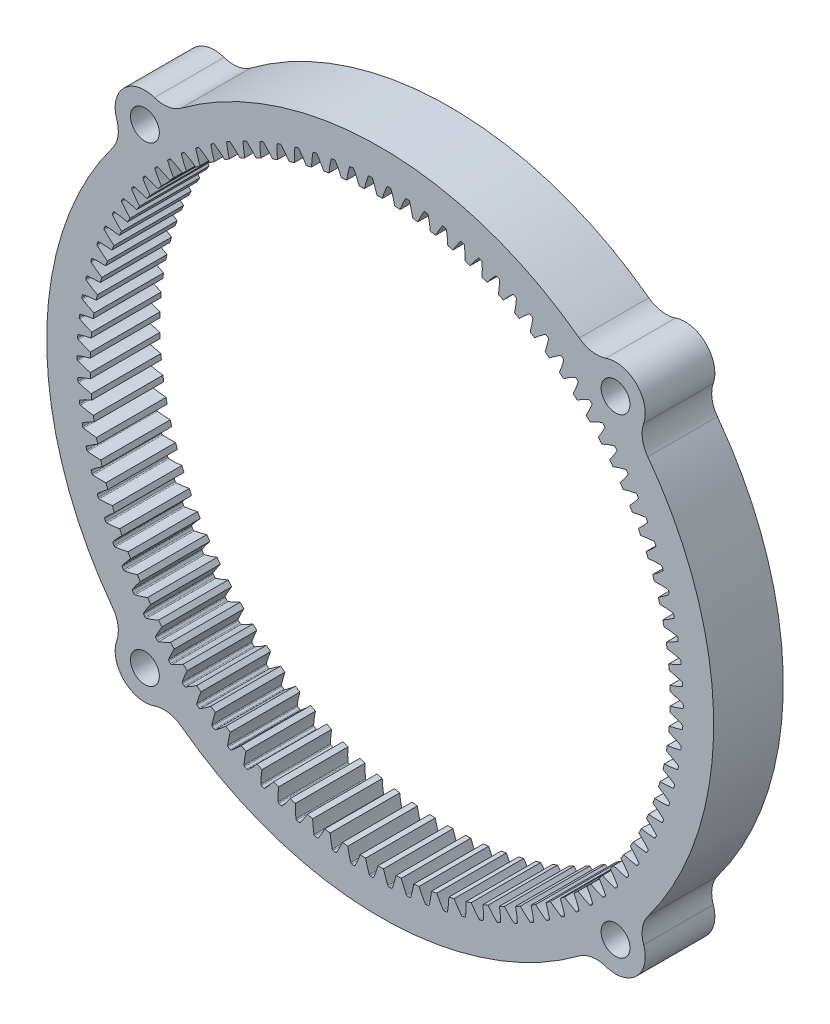
from build123d import *

# Parameters (mm, degrees)
SKETCH2_R           = 62.5
SKETCH2_R_2         = 50
BOSS_EXTRUDE1_DEPTH = 6
CUT_EXTRUDE2_START  = -7
CUT_EXTRUDE2_DEPTH  = 14
CIRPATTERN1_COUNT   = 102
FILLET1_R           = 0.2
SKETCH4_R           = 2.4892
CUT_EXTRUDE3_DEPTH  = 90.199215397
SKETCH5_OUTSIDE_W   = 162.436
SKETCH5_OUTSIDE_H   = 162.436
CUT_EXTRUDE5_DEPTH  = 90.199215397


with BuildPart() as part:
    # Sketch2 → Boss-Extrude1 (new, symmetric)
    with BuildSketch(Plane.XY):
        Circle(SKETCH2_R)
        Circle(SKETCH2_R_2, mode=Mode.SUBTRACT)
    extrude(amount=BOSS_EXTRUDE1_DEPTH, both=True)

    # Cut-Extrude2: read off the stored shape, not the designer's step
    # Cut-Extrude2 outline → Cut-Extrude2 (cut)
    with BuildSketch(Plane.XY.offset(CUT_EXTRUDE2_START)):
        with BuildLine():
            add(Edge.make_bspline(
                [(0.36845382, 49.998642399), (0.405796112, 50.131110984), (0.500958985, 50.452742938), (0.667166086, 50.959461897), (0.876071493, 51.517271253), (1.050120824, 51.940766609), (1.1530414, 52.179599707), (1.17792833, 52.236720656)],
                knots=[0.073064871, 0.073064871, 0.073064871, 0.073064871, 0.073064871, 0.092110525, 0.119476175, 0.146842495, 0.155464778, 0.155464778, 0.155464778, 0.155464778, 0.155464778], degree=4))
            ThreePointArc((0.36845382, 49.998642399), (1.442900025, 49.979176059), (2.516679717, 49.936623066))
            add(Edge.make_bspline(
                [(2.516679717, 49.936623066), (2.487041957, 50.071025326), (2.410593066, 50.397611659), (2.273896251, 50.913075385), (2.097519701, 51.482007868), (1.94819236, 51.914839178), (1.859221832, 52.15921226), (1.837671711, 52.217673954)],
                knots=[0.073064876, 0.073064876, 0.073064876, 0.073064876, 0.073064876, 0.092110525, 0.119476175, 0.146842495, 0.155464795, 0.155464795, 0.155464795, 0.155464795, 0.155464795], degree=4))
            ThreePointArc((1.837671711, 52.217673954), (1.507829971, 52.228238997), (1.17792833, 52.236720656))
        make_face()
    cut_extrude2 = extrude(amount=CUT_EXTRUDE2_DEPTH, mode=Mode.SUBTRACT)

    # CirPattern1: Cut-Extrude2 ×102 about axis
    cirpattern1_axis = Axis((0, 0, 6), (0, 0, -1))
    for i in range(1, CIRPATTERN1_COUNT):
        add(cut_extrude2.rotate(cirpattern1_axis, i * 360 / CIRPATTERN1_COUNT), mode=Mode.SUBTRACT)

    # Fillet1
    fillet1_edges = [part.edges().sort_by_distance(p)[0] for p in [
        (52.175671437, -2.786002533, 0),
        (52.136316933, -3.444846467, 0),
        (52.248220181, 0.43126321, 0),
        (52.249499349, -0.228753812, 0),
        (52.122573529, 3.646893023, 0),
        (52.164481517, 2.988206583, 0),
        (51.799208103, 6.848688923, 0),
        (51.881585939, 6.193831688, 0),
        (51.279350538, 10.024505399, 0),
        (51.401885734, 9.375961467, 0),
        (50.564972831, 13.162295493, 0),
        (50.727200571, 12.522525013, 0),
        (16.958198933, 49.421472955, 0),
        (17.581122052, 49.203319582, 0),
        (19.968465462, 48.283774574, 0),
        (20.576777381, 48.027687255, 0),
        (22.902984762, 46.962919299, 0),
        (23.494377945, 46.66986946, 0),
        (25.750625195, 45.463917584, 0),
        (26.322856287, 45.135016865, 0),
        (33.666144801, 39.958143028, 0),
        (34.168197223, 39.529695281, 0),
        (36.062150684, 37.809837187, 0),
        (36.536875246, 37.351295262, 0),
        (31.1424317, 41.954873947, 0),
        (31.669907524, 41.558145626, 0),
        (28.500584687, 43.792455658, 0),
        (29.051483019, 43.42895169, 0),
        (40.435204224, 33.091641836, 0),
        (40.849981182, 32.578237336, 0),
        (38.321360477, 35.518105682, 0),
        (38.766956386, 35.031208987, 0),
        (42.395663391, 30.539650058, 0),
        (42.778048007, 30.001685272, 0),
        (44.195301285, 27.871810927, 0),
        (44.543843044, 27.31132654, 0),
        (45.827291263, 25.09824447, 0),
        (46.140668026, 24.517366591, 0),
        (47.285442629, 22.229471776, 0),
        (47.56246565, 21.630403873, 0),
        (48.564224114, 19.27637508, 0),
        (48.803842551, 18.661389625, 0),
        (49.658784863, 16.250156491, 0),
        (49.860089761, 15.621586333, 0),
        (13.883604147, 50.37169876, 0),
        (14.518775504, 50.192306864, 0),
        (10.756344095, 51.130847458, 0),
        (11.401354269, 50.990897534, 0),
        (7.588281545, 51.696039338, 0),
        (8.240683791, 51.596062264, 0),
        (4.391434044, 52.065130434, 0),
        (5.048753577, 52.005505457, 0),
        (-2.04004567, 52.210159104, 0),
        (-1.380381073, 52.231762928, 0),
        (1.17792833, 52.236720656, 0),
        (1.837671711, 52.217673954, 0),
        (-5.250281078, 51.985546536, 0),
        (-4.593197599, 52.047718935, 0),
        (-8.440600371, 51.563734983, 0),
        (-7.788590553, 51.666240116, 0),
        (-11.598901576, 50.946324522, 0),
        (-10.954438715, 51.088773551, 0),
        (-14.713204175, 50.135657201, 0),
        (-14.078732939, 50.317509769, 0),
        (-17.77169455, 49.134808159, 0),
        (-17.149621706, 49.355374437, 0),
        (-20.762770801, 47.947573961, 0),
        (-20.155456085, 48.206017265, 0),
        (-23.67508675, 46.578458191, 0),
        (-23.084833914, 46.873798157, 0),
        (-26.497594986, 45.032654375, 0),
        (-25.926643061, 45.363770677, 0),
        (-44.649362933, 27.138476186, 0),
        (-44.302996315, 27.700307363, 0),
        (-42.894008585, 29.835658658, 0),
        (-42.513712074, 30.375101583, 0),
        (-38.902440768, 34.880690967, 0),
        (-38.458735492, 35.369311201, 0),
        (-40.975942569, 32.419664258, 0),
        (-40.56315876, 32.934672639, 0),
        (-29.219588768, 43.316026275, 0),
        (-28.670103571, 43.681662877, 0),
        (-31.830742641, 41.435085652, 0),
        (-31.304808558, 41.833855568, 0),
        (-36.681368684, 37.209403267, 0),
        (-36.208425067, 37.669781851, 0),
        (-34.321151605, 39.396967556, 0),
        (-33.820763683, 39.827358115, 0),
        (-46.235346955, 24.338348177, 0),
        (-45.924224117, 24.920436388, 0),
        (-47.645944469, 21.445896478, 0),
        (-47.371245606, 22.046033662, 0),
        (-48.875804595, 18.472093147, 0),
        (-48.638571734, 19.08800278, 0),
        (-49.920262053, 15.42821884, 0),
        (-49.721395101, 16.057564564, 0),
        (-50.775354859, 12.325820014, 0),
        (-50.615608184, 12.966214506, 0),
        (-51.437839351, 9.176665131, 0),
        (-51.317818929, 9.825679156, 0),
        (-51.9052025, 5.992700014, 0),
        (-51.825363609, 6.647871638, 0),
        (-52.175671437, 2.786002533, 0),
        (-52.136316933, 3.444846467, 0),
        (-52.248220181, -0.43126321, 0),
        (-52.249499349, 0.228753812, 0),
        (-52.122573529, -3.646893023, 0),
        (-52.164481517, -2.988206583, 0),
        (-51.799208103, -6.848688923, 0),
        (-51.881585939, -6.193831688, 0),
        (-51.279350538, -10.024505399, 0),
        (-51.401885734, -9.375961467, 0),
        (-50.564972831, -13.162295493, 0),
        (-50.727200571, -12.522525013, 0),
        (-49.658784863, -16.250156491, 0),
        (-49.860089761, -15.621586333, 0),
        (-48.564224114, -19.27637508, 0),
        (-48.803842551, -18.661389625, 0),
        (-47.285442629, -22.229471776, 0),
        (-47.56246565, -21.630403873, 0),
        (-36.062150684, -37.809837187, 0),
        (-36.536875246, -37.351295262, 0),
        (-38.321360477, -35.518105682, 0),
        (-38.766956386, -35.031208987, 0),
        (-31.1424317, -41.954873947, 0),
        (-31.669907524, -41.558145626, 0),
        (-33.666144801, -39.958143028, 0),
        (-34.168197223, -39.529695281, 0),
        (-40.435204224, -33.091641836, 0),
        (-40.849981182, -32.578237336, 0),
        (-42.395663391, -30.539650058, 0),
        (-42.778048007, -30.001685272, 0),
        (-44.195301285, -27.871810927, 0),
        (-44.543843044, -27.31132654, 0),
        (-45.827291263, -25.09824447, 0),
        (-46.140668026, -24.517366591, 0),
        (-28.500584687, -43.792455658, 0),
        (-29.051483019, -43.42895169, 0),
        (-25.750625195, -45.463917584, 0),
        (-26.322856287, -45.135016865, 0),
        (-22.902984762, -46.962919299, 0),
        (-23.494377945, -46.66986946, 0),
        (-19.968465462, -48.283774574, 0),
        (-20.576777381, -48.027687255, 0),
        (-16.958198933, -49.421472955, 0),
        (-17.581122052, -49.203319582, 0),
        (-13.883604147, -50.37169876, 0),
        (-14.518775504, -50.192306864, 0),
        (-10.756344095, -51.130847458, 0),
        (-11.401354269, -50.990897534, 0),
        (-7.588281545, -51.696039338, 0),
        (-8.240683791, -51.596062264, 0),
        (-4.391434044, -52.065130434, 0),
        (-5.048753577, -52.005505457, 0),
        (-1.17792833, -52.236720656, 0),
        (-1.837671711, -52.217673954, 0),
        (2.04004567, -52.210159104, 0),
        (1.380381073, -52.231762928, 0),
        (5.250281078, -51.985546536, 0),
        (4.593197599, -52.047718935, 0),
        (8.440600371, -51.563734983, 0),
        (7.788590553, -51.666240116, 0),
        (11.598901576, -50.946324522, 0),
        (10.954438715, -51.088773551, 0),
        (14.713204175, -50.135657201, 0),
        (14.078732939, -50.317509769, 0),
        (17.77169455, -49.134808159, 0),
        (17.149621706, -49.355374437, 0),
        (20.762770801, -47.947573961, 0),
        (20.155456085, -48.206017265, 0),
        (23.67508675, -46.578458191, 0),
        (23.084833914, -46.873798157, 0),
        (26.497594986, -45.032654375, 0),
        (25.926643061, -45.363770677, 0),
        (29.219588768, -43.316026275, 0),
        (28.670103571, -43.681662877, 0),
        (36.681368684, -37.209403267, 0),
        (36.208425067, -37.669781851, 0),
        (38.902440768, -34.880690967, 0),
        (38.458735492, -35.369311201, 0),
        (31.830742641, -41.435085652, 0),
        (31.304808558, -41.833855568, 0),
        (34.321151605, -39.396967556, 0),
        (33.820763683, -39.827358115, 0),
        (40.975942569, -32.419664258, 0),
        (40.56315876, -32.934672639, 0),
        (42.894008585, -29.835658658, 0),
        (42.513712074, -30.375101583, 0),
        (44.649362933, -27.138476186, 0),
        (44.302996315, -27.700307363, 0),
        (46.235346955, -24.338348177, 0),
        (45.924224117, -24.920436388, 0),
        (47.645944469, -21.445896478, 0),
        (47.371245606, -22.046033662, 0),
        (48.875804595, -18.472093147, 0),
        (48.638571734, -19.08800278, 0),
        (49.920262053, -15.42821884, 0),
        (49.721395101, -16.057564564, 0),
        (50.775354859, -12.325820014, 0),
        (50.615608184, -12.966214506, 0),
        (51.437839351, -9.176665131, 0),
        (51.317818929, -9.825679156, 0),
        (51.9052025, -5.992700014, 0),
        (51.825363609, -6.647871638, 0),
    ]]
    fillet(fillet1_edges, radius=FILLET1_R)

    # Sketch4 → Cut-Extrude3 (cut, through all)
    with BuildSketch(Plane.XY.offset(6)):
        with Locations((-40.570251571, -40.570251571)):
            Circle(SKETCH4_R)
        with Locations((-40.570251571, 40.570251571)):
            Circle(SKETCH4_R)
        with Locations((40.570251571, 40.570251571)):
            Circle(SKETCH4_R)
        with Locations((40.570251571, -40.570251571)):
            Circle(SKETCH4_R)
    extrude(amount=-CUT_EXTRUDE3_DEPTH, mode=Mode.SUBTRACT)

    # Sketch5 outside → Cut-Extrude5 (cut, through all)
    with BuildSketch(Plane.XY.offset(6)):
        Rectangle(SKETCH5_OUTSIDE_W, SKETCH5_OUTSIDE_H)
        with BuildLine():
            ThreePointArc((-34.313281716, -46.139448392), (0, -57.5), (34.313281716, -46.139448392))
            ThreePointArc((34.313281716, -46.139448392), (36.524515009, -45.211615141), (38.91344348, -45.420056922))
            ThreePointArc((38.91344348, -45.420056922), (44.194173824, -44.194173824), (45.420056922, -38.91344348))
            ThreePointArc((45.420056922, -38.91344348), (45.211615141, -36.524515009), (46.139448392, -34.313281716))
            ThreePointArc((46.139448392, -34.313281716), (57.5, 0), (46.139448392, 34.313281716))
            ThreePointArc((46.139448392, 34.313281716), (45.211615141, 36.524515009), (45.420056922, 38.91344348))
            ThreePointArc((45.420056922, 38.91344348), (44.194173824, 44.194173824), (38.91344348, 45.420056922))
            ThreePointArc((38.91344348, 45.420056922), (36.524515009, 45.211615141), (34.313281716, 46.139448392))
            ThreePointArc((34.313281716, 46.139448392), (0, 57.5), (-34.313281716, 46.139448392))
            ThreePointArc((-34.313281716, 46.139448392), (-36.524515009, 45.211615141), (-38.91344348, 45.420056922))
            ThreePointArc((-38.91344348, 45.420056922), (-44.194173824, 44.194173824), (-45.420056922, 38.91344348))
            ThreePointArc((-45.420056922, 38.91344348), (-45.211615141, 36.524515009), (-46.139448392, 34.313281716))
            ThreePointArc((-46.139448392, 34.313281716), (-57.5, 0), (-46.139448392, -34.313281716))
            ThreePointArc((-46.139448392, -34.313281716), (-45.211615141, -36.524515009), (-45.420056922, -38.91344348))
            ThreePointArc((-45.420056922, -38.91344348), (-44.194173824, -44.194173824), (-38.91344348, -45.420056922))
            ThreePointArc((-38.91344348, -45.420056922), (-36.524515009, -45.211615141), (-34.313281716, -46.139448392))
        make_face(mode=Mode.SUBTRACT)
    extrude(amount=-CUT_EXTRUDE5_DEPTH, mode=Mode.SUBTRACT)


solid = part.part
